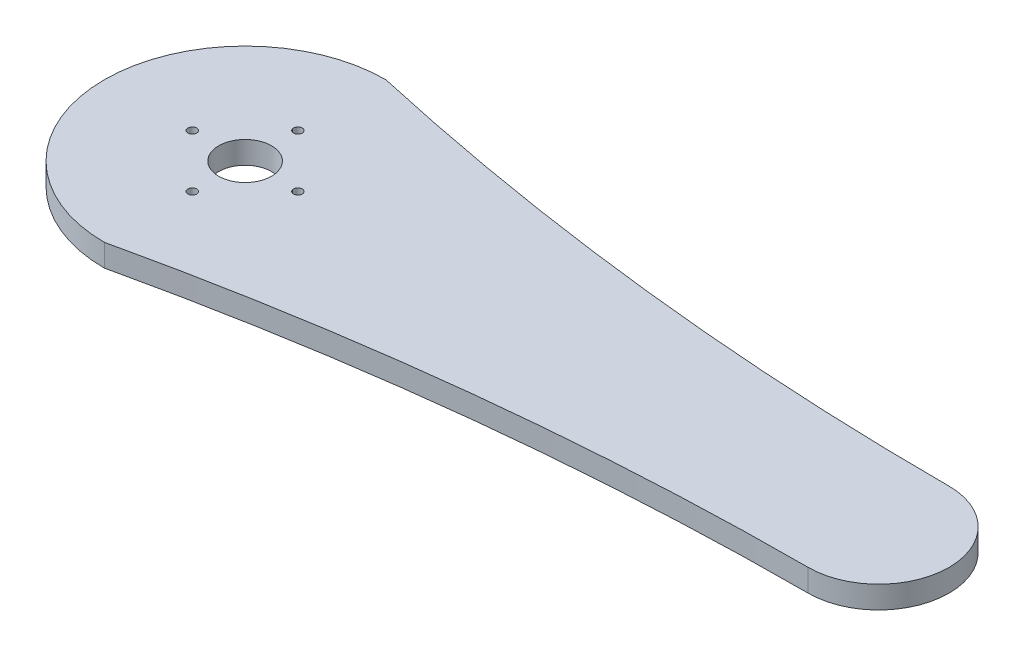
from build123d import *

# Parameters (mm, degrees)
SKETCH3_R           = 3.75
SKETCH3_R_2         = 0.625
BOSS_EXTRUDE1_DEPTH = 3.175


with BuildPart() as part:
    # Sketch3 → Boss-Extrude1 (new body)
    with BuildSketch(Plane(origin=(0, 0, 0), x_dir=(1, 0, 0), z_dir=(0, 1, 0))):
        with BuildLine():
            ThreePointArc((-40.372263643, 20), (-60.372263643, 0), (-40.372263643, -20))
            ThreePointArc((-40.372263643, -20), (4.350810667, -12.507668784), (49.627736357, -10))
            ThreePointArc((49.627736357, -10), (59.627736357, 0), (49.627736357, 10))
            ThreePointArc((49.627736357, 10), (4.350810667, 12.507668784), (-40.372263643, 20))
        make_face()
        with Locations((-40.372263643, 0)):
            Circle(SKETCH3_R, mode=Mode.SUBTRACT)
        with Locations((-32.872263643, 0)):
            Circle(SKETCH3_R_2, mode=Mode.SUBTRACT)
        with Locations((-47.872263643, 0)):
            Circle(SKETCH3_R_2, mode=Mode.SUBTRACT)
        with Locations((-40.372263643, 7.5)):
            Circle(SKETCH3_R_2, mode=Mode.SUBTRACT)
        with Locations((-40.372263643, -7.5)):
            Circle(SKETCH3_R_2, mode=Mode.SUBTRACT)
    extrude(amount=BOSS_EXTRUDE1_DEPTH)


solid = part.part
